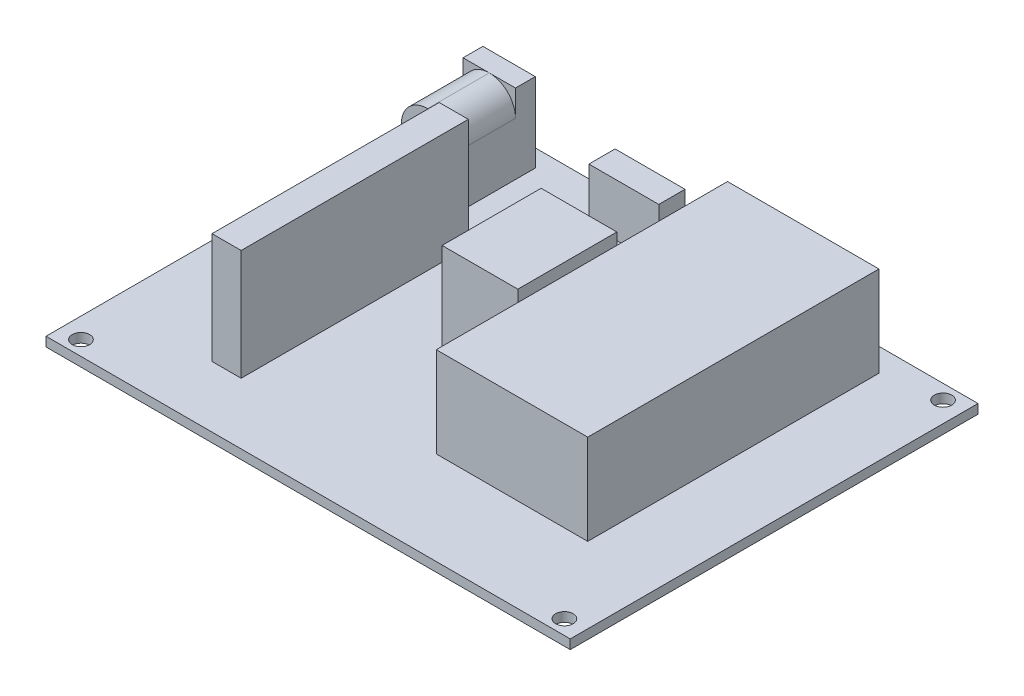
from build123d import *

# Parameters (mm, degrees)
SKETCH1_W           = 90
SKETCH1_H           = 70
BOSS_EXTRUDE1_DEPTH = 1.6
SKETCH2_R           = 1.5
CUT_EXTRUDE1_DEPTH  = 1.6
SKETCH3_W           = 5
SKETCH3_H           = 39
BOSS_EXTRUDE2_DEPTH = 19
SKETCH4_W           = 26
SKETCH4_H           = 50
SKETCH4_W_2         = 13
SKETCH4_H_2         = 17
BOSS_EXTRUDE3_DEPTH = 15.5
SKETCH5_W           = 9
SKETCH5_H           = 14
BOSS_EXTRUDE4_DEPTH = 13.6
SKETCH6_R           = 2.7
CUT_EXTRUDE2_DEPTH  = 8
FILLET1_START       = -28.6
FILLET1_DEPTH       = 10.6
SKETCH7_W           = 12
SKETCH7_H           = 4.5
BOSS_EXTRUDE5_DEPTH = 9


with BuildPart() as part:
    # Sketch1 → Boss-Extrude1 (new body)
    with BuildSketch(Plane(origin=(0, 0, 0), x_dir=(1, 0, 0), z_dir=(0, 1, 0))):
        Rectangle(SKETCH1_W, SKETCH1_H)
    extrude(amount=BOSS_EXTRUDE1_DEPTH)

    # Sketch2 → Cut-Extrude1 (cut)
    with BuildSketch(Plane(origin=(0, 1.6, 0), x_dir=(1, 0, 0), z_dir=(0, 1, 0))):
        with Locations(Location((-41.5, 32.5, 0), (0, 0, 270))):
            Circle(SKETCH2_R)
        with Locations(Location((41.5, 32.5, 0), (0, 0, 270))):
            Circle(SKETCH2_R)
        with Locations(Location((41.5, -32.5, 0), (0, 0, 270))):
            Circle(SKETCH2_R)
        with Locations(Location((-41.5, -32.5, 0), (0, 0, 270))):
            Circle(SKETCH2_R)
    extrude(amount=-CUT_EXTRUDE1_DEPTH, mode=Mode.SUBTRACT)

    # Sketch3 → Boss-Extrude2 (add)
    with BuildSketch(Plane(origin=(0, 1.6, 0), x_dir=(1, 0, 0), z_dir=(0, 1, 0))):
        with Locations((-24.5, -5)):
            Rectangle(SKETCH3_W, SKETCH3_H)
    extrude(amount=BOSS_EXTRUDE2_DEPTH)

    # Sketch4 → Boss-Extrude3 (add)
    with BuildSketch(Plane(origin=(0, 1.6, 0), x_dir=(1, 0, 0), z_dir=(0, 1, 0))):
        with Locations((19, 6)):
            Rectangle(SKETCH4_W, SKETCH4_H)
        with Locations((-2.5, 5.5)):
            Rectangle(SKETCH4_W_2, SKETCH4_H_2)
    extrude(amount=BOSS_EXTRUDE3_DEPTH)

    # Sketch5 → Boss-Extrude4 (add)
    with BuildSketch(Plane(origin=(0, 1.6, 0), x_dir=(1, 0, 0), z_dir=(0, 1, 0))):
        with Locations((-32.5, 25)):
            Rectangle(SKETCH5_W, SKETCH5_H)
    extrude(amount=BOSS_EXTRUDE4_DEPTH)

    # Sketch6 → Cut-Extrude2 (cut)
    with BuildSketch(Plane(origin=(0, 0, -32), x_dir=(-1, 0, 0), z_dir=(0, 0, -1))):
        with Locations((32.5, 10.7)):
            Circle(SKETCH6_R)
    extrude(amount=-CUT_EXTRUDE2_DEPTH, mode=Mode.SUBTRACT)

    # Fillet1: read off the stored shape, not the designer's step
    # Fillet1 outline → Fillet1 (cut)
    with BuildSketch(Plane.XY.offset(FILLET1_START)):
        with BuildLine():
            Line((-28, 15.2), (-32.5, 15.2))
            ThreePointArc((-32.5, 15.2), (-29.318019485, 13.881980515), (-28, 10.7))
            Line((-28, 10.7), (-28, 15.2))
        make_face()
        with BuildLine():
            ThreePointArc((-37, 10.7), (-35.681980515, 13.881980515), (-32.5, 15.2))
            Line((-32.5, 15.2), (-37, 15.2))
            Line((-37, 15.2), (-37, 10.7))
        make_face()
    extrude(amount=FILLET1_DEPTH, mode=Mode.SUBTRACT)

    # Sketch7 → Boss-Extrude5 (add)
    with BuildSketch(Plane(origin=(0, 1.6, 0), x_dir=(1, 0, 0), z_dir=(0, 1, 0))):
        with Locations((-9, 30.45)):
            Rectangle(SKETCH7_W, SKETCH7_H)
    extrude(amount=BOSS_EXTRUDE5_DEPTH)


solid = part.part
